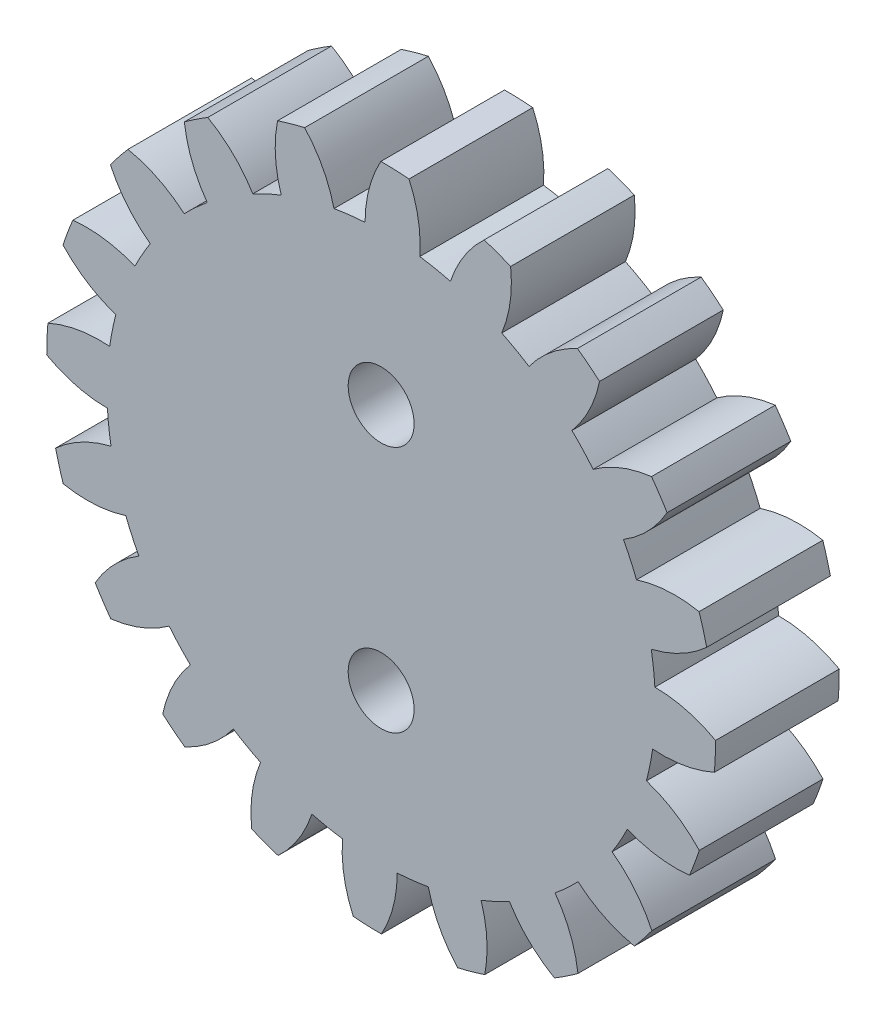
from build123d import *

# Parameters (mm, degrees)
EXTRUDE_4_DEPTH     = 3
CUT_EXTRUDE_1_REACH = 13.854
SKETCH_5_R          = 0.8


with BuildPart() as part:
    # 草图4 → 凸台-拉伸4 (new body)
    with BuildSketch(Plane.XY):
        with BuildLine():
            ThreePointArc((8.109259925, 0.007195304), (7.397764467, 0.292254868), (6.637585045, 0.390295618))
            ThreePointArc((6.637585045, 0.390295618), (6.604507127, 0.768343357), (6.549914936, 1.143888207))
            ThreePointArc((6.549914936, 1.143888207), (7.267285645, 1.413821546), (7.894339522, 1.854602872))
            ThreePointArc((7.894339522, 1.854602872), (7.809176661, 2.185613911), (7.710141023, 2.512742269))
            ThreePointArc((7.710141023, 2.512742269), (6.945380381, 2.563985838), (6.192110531, 2.422319772))
            ThreePointArc((6.192110531, 2.422319772), (6.043828385, 2.771642898), (5.875858386, 3.11193736))
            ThreePointArc((5.875858386, 3.11193736), (6.474704484, 3.590338961), (6.934859239, 4.203317219))
            ThreePointArc((6.934859239, 4.203317219), (6.751576509, 4.491810653), (6.556299797, 4.772324514))
            ThreePointArc((6.556299797, 4.772324514), (5.813134073, 4.584736009), (5.140509095, 4.217230388))
            ThreePointArc((5.140509095, 4.217230388), (4.891537611, 4.503634721), (4.626631877, 4.775368402))
            ThreePointArc((4.626631877, 4.775368402), (5.048334136, 5.415408984), (5.296546615, 6.140581589))
            ThreePointArc((5.296546615, 6.140581589), (5.033085007, 6.358317671), (4.760682268, 6.564758384))
            ThreePointArc((4.760682268, 6.564758384), (4.111857698, 6.156700276), (3.585718812, 5.599329112))
            ThreePointArc((3.585718812, 5.599329112), (3.260429054, 5.794779399), (2.924518404, 5.971353113))
            ThreePointArc((2.924518404, 5.971353113), (3.127797669, 6.710381044), (3.139771106, 7.47676305))
            ThreePointArc((3.139771106, 7.47676305), (2.821920077, 7.602428255), (2.499055988, 7.714587965))
            ThreePointArc((2.499055988, 7.714587965), (2.008084044, 7.126003823), (1.67993339, 6.433326489))
            ThreePointArc((1.67993339, 6.433326489), (1.310166985, 6.518690695), (0.936132694, 6.582820177))
            ThreePointArc((0.936132694, 6.582820177), (0.901090574, 7.348494254), (0.675652925, 8.081066849))
            ThreePointArc((0.675652925, 8.081066849), (0.334525948, 8.102360192), (-0.007195304, 8.109259925))
            ThreePointArc((-0.007195304, 8.109259925), (-0.292254868, 7.397764467), (-0.390295618, 6.637585045))
            ThreePointArc((-0.390295618, 6.637585045), (-0.768343357, 6.604507127), (-1.143888207, 6.549914936))
            ThreePointArc((-1.143888207, 6.549914936), (-1.413821546, 7.267285645), (-1.854602872, 7.894339522))
            ThreePointArc((-1.854602872, 7.894339522), (-2.185613911, 7.809176661), (-2.512742269, 7.710141023))
            ThreePointArc((-2.512742269, 7.710141023), (-2.563985838, 6.945380381), (-2.422319772, 6.192110531))
            ThreePointArc((-2.422319772, 6.192110531), (-2.771642898, 6.043828385), (-3.11193736, 5.875858386))
            ThreePointArc((-3.11193736, 5.875858386), (-3.590338961, 6.474704484), (-4.203317219, 6.934859239))
            ThreePointArc((-4.203317219, 6.934859239), (-4.491810653, 6.751576509), (-4.772324514, 6.556299797))
            ThreePointArc((-4.772324514, 6.556299797), (-4.584736009, 5.813134073), (-4.217230388, 5.140509095))
            ThreePointArc((-4.217230388, 5.140509095), (-4.503634721, 4.891537611), (-4.775368402, 4.626631877))
            ThreePointArc((-4.775368402, 4.626631877), (-5.415408984, 5.048334136), (-6.140581589, 5.296546615))
            ThreePointArc((-6.140581589, 5.296546615), (-6.358317671, 5.033085007), (-6.564758384, 4.760682268))
            ThreePointArc((-6.564758384, 4.760682268), (-6.156700276, 4.111857698), (-5.599329112, 3.585718812))
            ThreePointArc((-5.599329112, 3.585718812), (-5.794779399, 3.260429054), (-5.971353113, 2.924518404))
            ThreePointArc((-5.971353113, 2.924518404), (-6.710381044, 3.127797669), (-7.47676305, 3.139771106))
            ThreePointArc((-7.47676305, 3.139771106), (-7.602428255, 2.821920077), (-7.714587965, 2.499055988))
            ThreePointArc((-7.714587965, 2.499055988), (-7.126003823, 2.008084044), (-6.433326489, 1.67993339))
            ThreePointArc((-6.433326489, 1.67993339), (-6.518690695, 1.310166985), (-6.582820177, 0.936132694))
            ThreePointArc((-6.582820177, 0.936132694), (-7.348494254, 0.901090574), (-8.081066849, 0.675652925))
            ThreePointArc((-8.081066849, 0.675652925), (-8.102360192, 0.334525948), (-8.109259925, -0.007195304))
            ThreePointArc((-8.109259925, -0.007195304), (-7.397764467, -0.292254868), (-6.637585045, -0.390295618))
            ThreePointArc((-6.637585045, -0.390295618), (-6.604507127, -0.768343357), (-6.549914936, -1.143888207))
            ThreePointArc((-6.549914936, -1.143888207), (-7.267285646, -1.413821546), (-7.894339522, -1.854602872))
            ThreePointArc((-7.894339522, -1.854602872), (-7.809176662, -2.185613911), (-7.710141023, -2.512742269))
            ThreePointArc((-7.710141023, -2.512742269), (-6.945380381, -2.563985838), (-6.192110531, -2.422319772))
            ThreePointArc((-6.192110531, -2.422319772), (-6.043828385, -2.771642898), (-5.875858386, -3.11193736))
            ThreePointArc((-5.875858386, -3.11193736), (-6.474704484, -3.590338961), (-6.934859239, -4.203317219))
            ThreePointArc((-6.934859239, -4.203317219), (-6.751576509, -4.491810653), (-6.556299797, -4.772324514))
            ThreePointArc((-6.556299797, -4.772324514), (-5.813134073, -4.584736009), (-5.140509095, -4.217230388))
            ThreePointArc((-5.140509095, -4.217230388), (-4.891537611, -4.503634721), (-4.626631877, -4.775368402))
            ThreePointArc((-4.626631877, -4.775368402), (-5.048334136, -5.415408984), (-5.296546615, -6.140581589))
            ThreePointArc((-5.296546615, -6.140581589), (-5.033085007, -6.358317671), (-4.760682268, -6.564758384))
            ThreePointArc((-4.760682268, -6.564758384), (-4.111857698, -6.156700276), (-3.585718813, -5.599329112))
            ThreePointArc((-3.585718813, -5.599329112), (-3.260429054, -5.794779399), (-2.924518404, -5.971353114))
            ThreePointArc((-2.924518404, -5.971353114), (-3.127797669, -6.710381044), (-3.139771106, -7.47676305))
            ThreePointArc((-3.139771106, -7.47676305), (-2.821920077, -7.602428255), (-2.499055988, -7.714587965))
            ThreePointArc((-2.499055988, -7.714587965), (-2.008084044, -7.126003823), (-1.67993339, -6.433326489))
            ThreePointArc((-1.67993339, -6.433326489), (-1.310166985, -6.518690695), (-0.936132694, -6.582820177))
            ThreePointArc((-0.936132694, -6.582820177), (-0.901090574, -7.348494254), (-0.675652925, -8.081066849))
            ThreePointArc((-0.675652925, -8.081066849), (-0.334525948, -8.102360192), (0.007195304, -8.109259925))
            ThreePointArc((0.007195304, -8.109259925), (0.292254868, -7.397764467), (0.390295618, -6.637585045))
            ThreePointArc((0.390295618, -6.637585045), (0.768343357, -6.604507127), (1.143888207, -6.549914936))
            ThreePointArc((1.143888207, -6.549914936), (1.413821546, -7.267285645), (1.854602872, -7.894339522))
            ThreePointArc((1.854602872, -7.894339522), (2.185613911, -7.809176661), (2.512742269, -7.710141023))
            ThreePointArc((2.512742269, -7.710141023), (2.563985838, -6.945380381), (2.422319772, -6.192110531))
            ThreePointArc((2.422319772, -6.192110531), (2.771642898, -6.043828385), (3.11193736, -5.875858386))
            ThreePointArc((3.11193736, -5.875858386), (3.590338961, -6.474704484), (4.203317219, -6.934859239))
            ThreePointArc((4.203317219, -6.934859239), (4.491810653, -6.751576509), (4.772324514, -6.556299797))
            ThreePointArc((4.772324514, -6.556299797), (4.584736009, -5.813134073), (4.217230388, -5.140509095))
            ThreePointArc((4.217230388, -5.140509095), (4.503634721, -4.891537611), (4.775368402, -4.626631877))
            ThreePointArc((4.775368402, -4.626631877), (5.415408984, -5.048334136), (6.140581589, -5.296546615))
            ThreePointArc((6.140581589, -5.296546615), (6.358317671, -5.033085007), (6.564758384, -4.760682268))
            ThreePointArc((6.564758384, -4.760682268), (6.156700276, -4.111857698), (5.599329112, -3.585718812))
            ThreePointArc((5.599329112, -3.585718812), (5.794779399, -3.260429054), (5.971353113, -2.924518404))
            ThreePointArc((5.971353113, -2.924518404), (6.710381044, -3.127797669), (7.47676305, -3.139771106))
            ThreePointArc((7.47676305, -3.139771106), (7.602428255, -2.821920077), (7.714587965, -2.499055988))
            ThreePointArc((7.714587965, -2.499055988), (7.126003823, -2.008084044), (6.433326489, -1.67993339))
            ThreePointArc((6.433326489, -1.67993339), (6.518690695, -1.310166985), (6.582820177, -0.936132694))
            ThreePointArc((6.582820177, -0.936132694), (7.348494254, -0.901090574), (8.081066849, -0.675652925))
            ThreePointArc((8.081066849, -0.675652925), (8.102210984, -0.338120505), (8.109263117, 0))
            ThreePointArc((8.109263117, 0), (8.109262319, 0.003597652), (8.109259925, 0.007195304))
        make_face()
    extrude(amount=EXTRUDE_4_DEPTH)

    # 草图5 → 切除-拉伸1 (cut, up to next)
    with BuildSketch(Plane(origin=(0, 0, 0), x_dir=(-1, 0, 0), z_dir=(0, 0, -1)), mode=Mode.PRIVATE) as cut_extrude_1_sk1:
        with Locations((0, 3)):
            Circle(SKETCH_5_R)
    cut_extrude_1_tool1 = extrude(cut_extrude_1_sk1.sketch, amount=-CUT_EXTRUDE_1_REACH, mode=Mode.PRIVATE) & part.part
    # 草图5 → 切除-拉伸1 (cut, up to next)
    with BuildSketch(Plane(origin=(0, 0, 0), x_dir=(-1, 0, 0), z_dir=(0, 0, -1)), mode=Mode.PRIVATE) as cut_extrude_1_sk2:
        with Locations((0, -3)):
            Circle(SKETCH_5_R)
    cut_extrude_1_tool2 = extrude(cut_extrude_1_sk2.sketch, amount=-CUT_EXTRUDE_1_REACH, mode=Mode.PRIVATE) & part.part
    add(cut_extrude_1_tool1.solids().sort_by_distance((0, 3, 0))[0], mode=Mode.SUBTRACT)
    add(cut_extrude_1_tool2.solids().sort_by_distance((0, -3, 0))[0], mode=Mode.SUBTRACT)


solid = part.part
